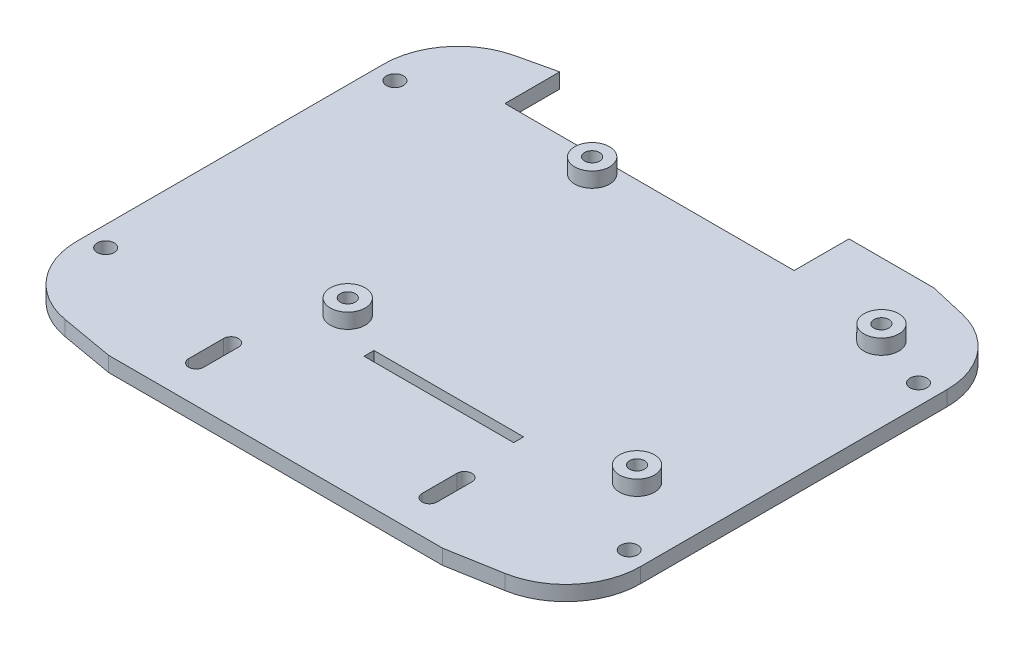
from build123d import *

# Parameters (mm, degrees)
BOSS_EXTRU_1_DEPTH       = 3
CONG_1_R                 = 20
CONG_2_R                 = 5
BOSS_EXTRU_2_DEPTH       = 5
CONG_4_R                 = 2
CONG_5_R                 = 4
ESQUISSE3_R              = 1.5
ENL_V_MAT_EXTRU_2_DEPTH  = 25
ESQUISSE4_R              = 1.7
ENL_V_MAT_EXTRU_3_DEPTH  = 25
ESQUISSE5_R              = 1.7
ENL_V_MAT_EXTRU_4_DEPTH  = 10
ESQUISSE6_R              = 1.7
ENL_V_MAT_EXTRU_5_DEPTH  = 10
CONG_6_R                 = 10
ENL_V_MAT_EXTRU_8_DEPTH  = 10
ESQUISSE8_R              = 1.5
ESQUISSE8_W              = 30
ESQUISSE8_H              = 2
ENL_V_MAT_EXTRU_10_DEPTH = 10
BOSS_EXTRU_3_START       = 3
ESQUISSE8_3_R            = 3.5
ESQUISSE8_3_R_2          = 1.5
BOSS_EXTRU_3_DEPTH       = 3
ENL_V_MAT_EXTRU_11_DEPTH = 6.5


with BuildPart() as part:
    # Esquisse1 → Boss.-Extru.1 (new body)
    with BuildSketch(Plane(origin=(0, 0, 0), x_dir=(1, 0, 0), z_dir=(0, 1, 0))):
        with BuildLine():
            Line((-37.5, 95), (37.5, 95))
            Line((37.5, 95), (37.5, 51))
            Line((37.5, 51), (44.874265815, 49.29751659))
            ThreePointArc((44.874265815, 49.29751659), (53.239122353, 44.019685168), (56.5, 34.681965619))
            Line((56.5, 34.681965619), (56.5, -26.800001164))
            ThreePointArc((56.5, -26.800001164), (52.990666647, -36.441815309), (44.104722665, -41.572117459))
            Line((44.104722665, -41.572117459), (17, -46.351411369))
            Line((17, -46.351411369), (17, -61.9))
            Line((17, -61.9), (27, -61.9))
            Line((27, -61.9), (27, -66.9))
            Line((27, -66.9), (17, -66.9))
            Line((17, -66.9), (17, -79.1))
            Line((17, -79.1), (27, -79.1))
            Line((27, -79.1), (27, -84.1))
            Line((27, -84.1), (17, -84.1))
            Line((17, -84.1), (17, -95))
            Line((17, -95), (-17, -95))
            Line((-17, -95), (-17, -84.1))
            Line((-17, -84.1), (-27, -84.1))
            Line((-27, -84.1), (-27, -79.1))
            Line((-27, -79.1), (-17, -79.1))
            Line((-17, -79.1), (-17, -66.9))
            Line((-17, -66.9), (-27, -66.9))
            Line((-27, -66.9), (-27, -61.9))
            Line((-27, -61.9), (-17, -61.9))
            Line((-17, -61.9), (-17, -46.351411369))
            Line((-17, -46.351411369), (-44.104722665, -41.572117459))
            ThreePointArc((-44.104722665, -41.572117459), (-52.990666647, -36.441815309), (-56.5, -26.800001164))
            Line((-56.5, -26.800001164), (-56.5, 34.681965619))
            ThreePointArc((-56.5, 34.681965619), (-53.239122353, 44.019685168), (-44.874265815, 49.29751659))
            Line((-44.874265815, 49.29751659), (-37.5, 51))
            Line((-37.5, 51), (-37.5, 95))
        make_face()
    extrude(amount=BOSS_EXTRU_1_DEPTH)

    # Congé1
    # the kernel refuses this fillet: 20 mm, written as the material it adds along each edge
    with BuildSketch(Plane(origin=(17, 0, 46.351411369), x_dir=(0.9848077530122094, 0, -0.1736481776669235), z_dir=(0, 1, 0))) as cong_1_piece_1:
        with BuildLine():
            CenterArc((16.742910017, -20), CONG_1_R, 90, 76.444834731)
            Line((-2.699984081, -15.312370632), (-3.088841963, -15.218618044))
            ThreePointArc((-3.088841963, -15.218618044), (-1.743915142, -7.586726045), (-0.393923101, 0.069459271))
            Line((-0.393923101, 0.069459271), (0, 0.4))
            Line((0, 0.4), (16.742910017, 0.4))
            Line((16.742910017, 0.4), (16.742910017, 0))
        make_face()
    extrude(amount=3)
    with BuildSketch(Plane(origin=(-17, 0, 46.351411369), x_dir=(0, 0, 1), z_dir=(0, 1, 0))) as cong_1_piece_2:
        with BuildLine():
            CenterArc((16.788779247, -19.961511146), CONG_1_R, 93.555165269, 76.444834731)
            Line((-2.907375813, -16.488547593), (-3.301298915, -16.419088322))
            Line((-3.301298915, -16.419088322), (-0.393923101, 0.069459271))
            Line((-0.393923101, 0.069459271), (0, 0.4))
            ThreePointArc((0, 0.4), (7.774294315, 0.4), (15.523784818, 0.399230223))
            Line((15.523784818, 0.399230223), (15.548588631, 0))
        make_face()
    extrude(amount=3)

    # Congé2
    cong_2_edges = [part.edges().sort_by_distance(p)[0] for p in [
        (-17, 1.5, 61.9),
        (17, 1.5, 61.9),
    ]]
    fillet(cong_2_edges, radius=CONG_2_R)

    # Esquisse2 → Boss.-Extru.2 (add)
    with BuildSketch(Plane.XY.offset(84.1)):
        Polygon((-27, 5), (-27, 8.904402326), (-16.833134842, 8.904402326), (-14.427579086, 3), (-14.427579086, 0), (-27, 0), align=None)
        Polygon((16.833134842, 8.904402326), (14.427579086, 3), (14.427579086, 0), (27, 0), (27, 5), (27, 8.904402326), align=None)
    boss_extru_2 = extrude(amount=-BOSS_EXTRU_2_DEPTH)

    # Symétrie1: Boss.-Extru.2 across plane
    add(boss_extru_2.mirror(Plane.XY.offset(73)))

    # Congé4
    cong_4_edges = [part.edges().sort_by_distance(p)[0] for p in [
        (16.833134842, 8.904402326, 81.6),
        (14.427579086, 3, 81.6),
        (-16.833134842, 8.904402326, 81.6),
        (-14.427579086, 3, 81.6),
        (16.833134842, 8.904402326, 64.4),
        (14.427579086, 3, 64.4),
        (-14.427579086, 3, 64.4),
        (-16.833134842, 8.904402326, 64.4),
    ]]
    fillet(cong_4_edges, radius=CONG_4_R)

    # Congé5
    cong_5_edges = [part.edges().sort_by_distance(p)[0] for p in [
        (27, 8.904402326, 81.6),
        (-27, 8.904402326, 81.6),
        (27, 8.904402326, 64.4),
        (-27, 8.904402326, 64.4),
        (-27, 0, 64.4),
        (-27, 0, 81.6),
        (27, 0, 81.6),
        (27, 0, 64.4),
    ]]
    fillet(cong_5_edges, radius=CONG_5_R)

    # Esquisse3 → Enlèv. mat.-Extru.2 (cut)
    with BuildSketch(Plane.XY.offset(84.1)):
        with Locations((-22, 4.452201163)):
            Circle(ESQUISSE3_R)
        with Locations(Location((22, 4.452201163, 0), (0, 0, 284.503100137))):
            Circle(ESQUISSE3_R)
    extrude(amount=-ENL_V_MAT_EXTRU_2_DEPTH, mode=Mode.SUBTRACT)

    # Esquisse4 → Enlèv. mat.-Extru.3 (cut)
    with BuildSketch(Plane(origin=(0, 3, 0), x_dir=(1, 0, 0), z_dir=(0, 1, 0))):
        with Locations(Location((-10, -90.8, 0), (0, 0, 270))):
            Circle(ESQUISSE4_R)
        with Locations(Location((10, -90.8, 0), (0, 0, 270))):
            Circle(ESQUISSE4_R)
        with Locations(Location((8.90673672, -64.828011588, 0), (0, 0, 270))):
            Circle(ESQUISSE4_R)
        with Locations(Location((8.90673672, -81.171988412, 0), (0, 0, 270))):
            Circle(ESQUISSE4_R)
        with Locations(Location((-8.90673672, -81.171988412, 0), (0, 0, 270))):
            Circle(ESQUISSE4_R)
        with Locations(Location((-8.90673672, -64.828011588, 0), (0, 0, 270))):
            Circle(ESQUISSE4_R)
    extrude(amount=-ENL_V_MAT_EXTRU_3_DEPTH, mode=Mode.SUBTRACT)

    # Esquisse5 → Enlèv. mat.-Extru.4 (cut)
    with BuildSketch(Plane(origin=(0, 3, 0), x_dir=(1, 0, 0), z_dir=(0, 1, 0))):
        with Locations(Location((15.5, 83, 0), (0, 0, 270))):
            Circle(ESQUISSE5_R)
        with Locations(Location((15.5, 49, 0), (0, 0, 270))):
            Circle(ESQUISSE5_R)
        with Locations(Location((-13, 83, 0), (0, 0, 270))):
            Circle(ESQUISSE5_R)
        with Locations(Location((-13, 67, 0), (0, 0, 270))):
            Circle(ESQUISSE5_R)
        with Locations(Location((27.5, 80, 0), (0, 0, 270))):
            Circle(ESQUISSE5_R)
        with Locations(Location((27.5, 55, 0), (0, 0, 270))):
            Circle(ESQUISSE5_R)
        with Locations(Location((27.5, 89, 0), (0, 0, 270))):
            Circle(ESQUISSE5_R)
        with Locations(Location((-27.5, 89, 0), (0, 0, 270))):
            Circle(ESQUISSE5_R)
        with Locations(Location((-27.5, 80, 0), (0, 0, 270))):
            Circle(ESQUISSE5_R)
        with Locations(Location((-27.5, 55, 0), (0, 0, 270))):
            Circle(ESQUISSE5_R)
        with Locations(Location((0, 89, 0), (0, 0, 270))):
            Circle(ESQUISSE5_R)
    extrude(amount=-ENL_V_MAT_EXTRU_4_DEPTH, mode=Mode.SUBTRACT)

    # Esquisse6 → Enlèv. mat.-Extru.5 (cut)
    with BuildSketch(Plane(origin=(0, 3, 0), x_dir=(1, 0, 0), z_dir=(0, 1, 0))):
        with Locations(Location((-52.484739006, 32.940982227, 0), (0, 0, 270))):
            Circle(ESQUISSE6_R)
        with Locations(Location((-52.484739006, -25.059017773, 0), (0, 0, 270))):
            Circle(ESQUISSE6_R)
        with Locations(Location((52.484739006, -25.059017773, 0), (0, 0, 90))):
            Circle(ESQUISSE6_R)
        with Locations(Location((52.484739006, 32.940982227, 0), (0, 0, 90))):
            Circle(ESQUISSE6_R)
    extrude(amount=-ENL_V_MAT_EXTRU_5_DEPTH, mode=Mode.SUBTRACT)

    # Congé6
    cong_6_edges = [part.edges().sort_by_distance(p)[0] for p in [
        (37.5, 1.5, -95),
        (-37.5, 1.5, -95),
    ]]
    fillet(cong_6_edges, radius=CONG_6_R)

    # Esquisse7 → Enlèv. mat.-Extru.8 (cut, symmetric)
    with BuildSketch(Plane(origin=(0, 3, 0), x_dir=(1, 0, 0), z_dir=(0, 1, 0))):
        Polygon((-86.454887478, 51), (-37.5, 51), (-37.5, 40), (20.5, 40), (20.5, 51), (91.524772855, 51), (68.271042048, 103.22710764), (-47.050718145, 103.22710764), align=None)
        Polygon((-33.488547593, -43.444035556), (33.488547593, -43.444035556), (53.128015595, -56.162105977), (47.497778975, -107.906661581), (-41.245474419, -107.906661581), (-59.476716808, -77.074413423), align=None)
    extrude(amount=ENL_V_MAT_EXTRU_8_DEPTH, both=True, mode=Mode.SUBTRACT)

    # Esquisse8 → Enlèv. mat.-Extru.10 (cut, symmetric)
    with BuildSketch(Plane(origin=(0, 3, 0), x_dir=(1, 0, 0), z_dir=(0, 1, 0))):
        with Locations(Location((41.5, 36.5, 0), (0, 0, 90))):
            Circle(ESQUISSE8_R)
        with Locations((7.26572134, -17)):
            Rectangle(ESQUISSE8_W, ESQUISSE8_H)
        with Locations(Location((-16.5, -12.5, 0), (0, 0, 90))):
            Circle(ESQUISSE8_R)
        with Locations(Location((-16.5, 36.5, 0), (0, 0, 90))):
            Circle(ESQUISSE8_R)
        with Locations(Location((41.5, -12.5, 0), (0, 0, 90))):
            Circle(ESQUISSE8_R)
    extrude(amount=ENL_V_MAT_EXTRU_10_DEPTH, both=True, mode=Mode.SUBTRACT)

    # Esquisse8<3> → Boss.-Extru.3 (add)
    # profile 1 of 4: a face of its own
    with BuildSketch(Plane(origin=(0, 3, 0), x_dir=(1, 0, 0), z_dir=(0, 1, 0)).offset(BOSS_EXTRU_3_START)):
        with Locations(Location((-16.5, -12.5, 0), (0, 0, 90))):
            Circle(ESQUISSE8_3_R)
        with Locations(Location((-16.5, -12.5, 0), (0, 0, 270))):
            Circle(ESQUISSE8_3_R_2, mode=Mode.SUBTRACT)
    # profile 2 of 4: a face of its own
    with BuildSketch(Plane(origin=(0, 3, 0), x_dir=(1, 0, 0), z_dir=(0, 1, 0)).offset(BOSS_EXTRU_3_START)):
        with Locations(Location((41.5, -12.5, 0), (0, 0, 90))):
            Circle(ESQUISSE8_3_R)
        with Locations(Location((41.5, -12.5, 0), (0, 0, 270))):
            Circle(ESQUISSE8_3_R_2, mode=Mode.SUBTRACT)
    # profile 3 of 4: a face of its own
    with BuildSketch(Plane(origin=(0, 3, 0), x_dir=(1, 0, 0), z_dir=(0, 1, 0)).offset(BOSS_EXTRU_3_START)):
        with Locations(Location((41.5, 36.5, 0), (0, 0, 90))):
            Circle(ESQUISSE8_3_R)
        with Locations(Location((41.5, 36.5, 0), (0, 0, 270))):
            Circle(ESQUISSE8_3_R_2, mode=Mode.SUBTRACT)
    # profile 4 of 4: a face of its own
    with BuildSketch(Plane(origin=(0, 3, 0), x_dir=(1, 0, 0), z_dir=(0, 1, 0)).offset(BOSS_EXTRU_3_START)):
        with Locations(Location((-16.5, 36.5, 0), (0, 0, 90))):
            Circle(ESQUISSE8_3_R)
        with Locations(Location((-16.5, 36.5, 0), (0, 0, 270))):
            Circle(ESQUISSE8_3_R_2, mode=Mode.SUBTRACT)
    extrude(amount=-BOSS_EXTRU_3_DEPTH)

    # Esquisse10 → Enlèv. mat.-Extru.11 (cut, symmetric)
    with BuildSketch(Plane(origin=(0, 3, 0), x_dir=(1, 0, 0), z_dir=(0, 1, 0))):
        with BuildLine():
            Line((-24.9, -36), (-24.9, -29))
            ThreePointArc((-24.9, -29), (-23.4, -27.5), (-21.9, -29))
            Line((-21.9, -29), (-21.9, -36))
            ThreePointArc((-21.9, -36), (-23.4, -37.5), (-24.9, -36))
        make_face()
        with BuildLine():
            Line((24.9, -36), (24.9, -29))
            ThreePointArc((24.9, -29), (23.4, -27.5), (21.9, -29))
            Line((21.9, -29), (21.9, -36))
            ThreePointArc((21.9, -36), (23.4, -37.5), (24.9, -36))
        make_face()
    extrude(amount=ENL_V_MAT_EXTRU_11_DEPTH, both=True, mode=Mode.SUBTRACT)


solid = part.part
